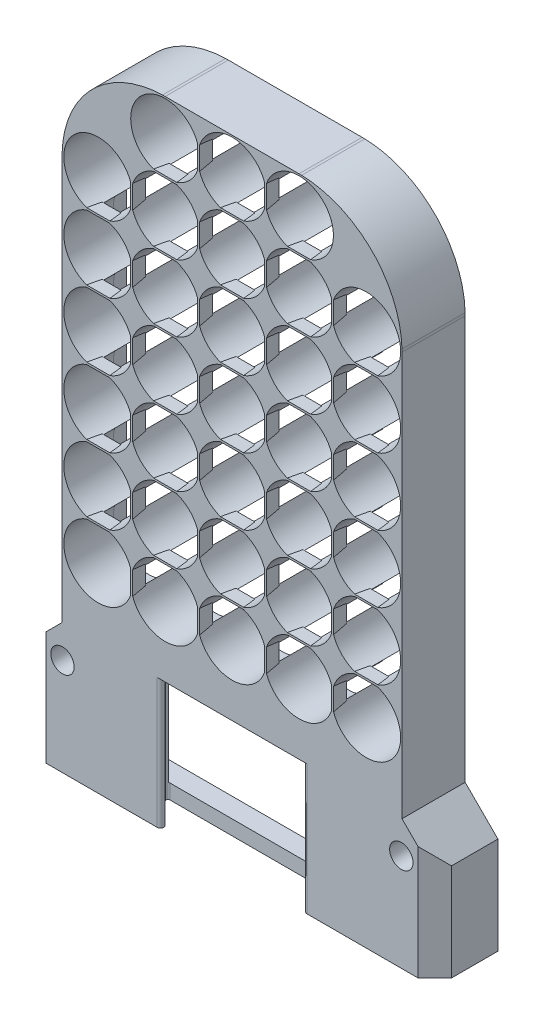
from build123d import *

# Parameters (mm, degrees)
BOSS_EXTRUDE1_DEPTH     = 7.44
BOSS_EXTRUDE2_DEPTH     = 2
BOSS_EXTRUDE3_START     = -90
BOSS_EXTRUDE3_DEPTH     = 61.267949192
BOSS_EXTRUDE3_START_2   = -35.267949192
BOSS_EXTRUDE3_2_DEPTH   = 11.267949192
BOSS_EXTRUDE3_START_3   = -150
BOSS_EXTRUDE3_3_DEPTH   = 45
BOSS_EXTRUDE3_START_4   = -145.717949192
BOSS_EXTRUDE3_4_DEPTH   = 36.585898384
SKETCH3_R               = 2
CUT_EXTRUDE1_DEPTH      = 5
CUT_EXTRUDE2_DEPTH      = 197.424683165
CUT_EXTRUDE2_DEPTH_BACK = 197.424683165
SKETCH3_3_R             = 1.75
SKETCH5_W               = 44.7
SKETCH5_H               = 9.35
SKETCH5_W_2             = 5.75
CUT_EXTRUDE4_DEPTH      = 3
CHAMFER1_SIZE           = 2.5
FILLET1_R               = 2
CUT_EXTRUDE5_DEPTH      = 185.400260716
CUT_EXTRUDE5_DEPTH_BACK = 19.41569
FILLET2_R               = 0.5
FILLET3_START           = -116.8
FILLET3_DEPTH           = 20.8
FILLET3_2_DEPTH         = 2.2


with BuildPart() as part:
    # Boss-Extrude1: read off the stored shape, not the designer's step
    # Boss-Extrude1 outline → Boss-Extrude1 (new body)
    # profile 1 of 23: a face of its own
    with BuildSketch(Plane.XY):
        with BuildLine():
            Line((-137.4513088, -21.6), (-137.84926681, -21.602604265))
            add(Edge.make_bspline(
                [(-137.84926681, -21.602604265), (-138.83224748, -21.628344539), (-139.797012541, -21.746478614), (-141.217778733, -22.057492317), (-141.686974424, -22.183446073), (-142.616297176, -22.481351779), (-143.078556166, -22.654380436), (-144.425538693, -23.232751514), (-145.276334986, -23.698482743), (-146.483154795, -24.51490475), (-146.873845835, -24.806716558), (-147.631022773, -25.431449942), (-147.993818982, -25.761528457), (-149.026143305, -26.793153314), (-149.644227383, -27.540113591), (-150.465753178, -28.749709063), (-150.723191535, -29.170186804), (-151.193408511, -30.028498367), (-151.40642385, -30.466061686), (-151.981781323, -31.802988292), (-152.280278036, -32.726647925), (-152.596808175, -34.162071159), (-152.679924825, -34.647584264), (-152.798636022, -35.620282225), (-152.834525316, -36.109232071), (-152.847395735, -36.60073319)],
                knots=[0, 0, 0, 0, 0.125, 0.125, 0.1875, 0.1875, 0.25, 0.25, 0.375, 0.375, 0.4375, 0.4375, 0.5, 0.5, 0.625, 0.625, 0.6875, 0.6875, 0.75, 0.75, 0.875, 0.875, 0.9375, 0.9375, 1, 1, 1, 1], degree=3))
            Line((-152.847395735, -36.60073319), (-152.85, -36.9986912))
            Line((-152.85, -36.9986912), (-152.85, -97.384314575))
            Line((-152.85, -97.384314575), (-157.75, -102.284314575))
            Line((-157.75, -102.284314575), (-157.75, -116.8))
            Line((-157.75, -116.8), (-97.15, -116.8))
            Line((-97.15, -116.8), (-97.15, -102.284314575))
            Line((-97.15, -102.284314575), (-102.05, -97.384314575))
            Line((-102.05, -97.384314575), (-102.05, -36.9986912))
            Line((-102.05, -36.9986912), (-102.052604265, -36.60073319))
            add(Edge.make_bspline(
                [(-102.052604265, -36.60073319), (-102.078344539, -35.61775252), (-102.196478614, -34.652987459), (-102.507492317, -33.232221267), (-102.633446073, -32.763025576), (-102.931351779, -31.833702824), (-103.104380436, -31.371443834), (-103.682751514, -30.024461307), (-104.148482743, -29.173665014), (-104.96490475, -27.966845205), (-105.256716558, -27.576154165), (-105.881449942, -26.818977227), (-106.211528457, -26.456181018), (-107.243153314, -25.423856695), (-107.990113591, -24.805772617), (-109.199709063, -23.984246822), (-109.620186804, -23.726808465), (-110.478498367, -23.256591489), (-110.916061686, -23.04357615), (-112.252988292, -22.468218677), (-113.176647925, -22.169721964), (-114.612071159, -21.853191825), (-115.097584264, -21.770075175), (-116.070282225, -21.651363978), (-116.559232071, -21.615474684), (-117.05073319, -21.602604265)],
                knots=[0, 0, 0, 0, 0.125, 0.125, 0.1875, 0.1875, 0.25, 0.25, 0.375, 0.375, 0.4375, 0.4375, 0.5, 0.5, 0.625, 0.625, 0.6875, 0.6875, 0.75, 0.75, 0.875, 0.875, 0.9375, 0.9375, 1, 1, 1, 1], degree=3))
            Line((-117.05073319, -21.602604265), (-117.4486912, -21.6))
            Line((-117.4486912, -21.6), (-137.4513088, -21.6))
        make_face()
        with BuildLine():
            ThreePointArc((-106.166103732, -52), (-102.25, -57), (-106.166103732, -62))
            ThreePointArc((-106.166103732, -62), (-102.25, -67), (-106.166103732, -72))
            ThreePointArc((-106.166103732, -72), (-102.25, -77), (-106.166103732, -82))
            ThreePointArc((-106.166103732, -82), (-103.797150916, -90.679942728), (-112.425, -88.127774357))
            ThreePointArc((-112.425, -88.127774357), (-117.395486561, -92.149711476), (-122.45, -88.233896268))
            ThreePointArc((-122.45, -88.233896268), (-127.45, -92.15), (-132.45, -88.233896268))
            ThreePointArc((-132.45, -88.233896268), (-137.45, -92.15), (-142.45, -88.233896268))
            ThreePointArc((-142.45, -88.233896268), (-151.091599923, -90.641599923), (-148.683896268, -82))
            ThreePointArc((-148.683896268, -82), (-152.6, -77), (-148.683896268, -72))
            ThreePointArc((-148.683896268, -72), (-152.6, -67), (-148.683896268, -62))
            ThreePointArc((-148.683896268, -62), (-152.6, -57), (-148.683896268, -52))
            ThreePointArc((-148.683896268, -52), (-152.6, -47), (-148.683896268, -42))
            ThreePointArc((-148.683896268, -42), (-151.091599923, -33.358400077), (-142.45, -35.766103732))
            ThreePointArc((-142.45, -35.766103732), (-141.091599923, -33.358400077), (-138.683896268, -32))
            ThreePointArc((-138.683896268, -32), (-141.091599923, -23.358400077), (-132.45, -25.766103732))
            ThreePointArc((-132.45, -25.766103732), (-127.45, -21.85), (-122.45, -25.766103732))
            ThreePointArc((-122.45, -25.766103732), (-113.808400077, -23.358400077), (-116.216103732, -32))
            ThreePointArc((-116.216103732, -32), (-113.770057272, -33.397150916), (-112.425, -35.872225643))
            ThreePointArc((-112.425, -35.872225643), (-103.797150916, -33.320057272), (-106.166103732, -42))
            ThreePointArc((-106.166103732, -42), (-102.25, -47), (-106.166103732, -52))
        make_face(mode=Mode.SUBTRACT)
    # profile 2 of 23: a face of its own
    with BuildSketch(Plane.XY):
        with BuildLine():
            ThreePointArc((-146.216103732, -42), (-143.808400077, -43.358400077), (-142.45, -45.766103732))
            ThreePointArc((-142.45, -45.766103732), (-141.091599923, -43.358400077), (-138.683896268, -42))
            ThreePointArc((-138.683896268, -42), (-141.091599923, -40.641599923), (-142.45, -38.233896268))
            ThreePointArc((-142.45, -38.233896268), (-143.808400077, -40.641599923), (-146.216103732, -42))
        make_face()
    # profile 3 of 23: a face of its own
    with BuildSketch(Plane.XY):
        with BuildLine():
            ThreePointArc((-112.425, -78.127774357), (-113.770057272, -80.602849084), (-116.216103732, -82))
            ThreePointArc((-116.216103732, -82), (-113.770057272, -83.397150916), (-112.425, -85.872225643))
            ThreePointArc((-112.425, -85.872225643), (-111.079942728, -83.397150916), (-108.633896268, -82))
            ThreePointArc((-108.633896268, -82), (-111.079942728, -80.602849084), (-112.425, -78.127774357))
        make_face()
    # profile 4 of 23: a face of its own
    with BuildSketch(Plane.XY):
        with BuildLine():
            ThreePointArc((-126.216103732, -82), (-123.808400077, -83.358400077), (-122.45, -85.766103732))
            ThreePointArc((-122.45, -85.766103732), (-121.091599923, -83.358400077), (-118.683896268, -82))
            ThreePointArc((-118.683896268, -82), (-121.091599923, -80.641599923), (-122.45, -78.233896268))
            ThreePointArc((-122.45, -78.233896268), (-123.808400077, -80.641599923), (-126.216103732, -82))
        make_face()
    # profile 5 of 23: a face of its own
    with BuildSketch(Plane.XY):
        with BuildLine():
            ThreePointArc((-136.216103732, -82), (-133.808400077, -83.358400077), (-132.45, -85.766103732))
            ThreePointArc((-132.45, -85.766103732), (-131.091599923, -83.358400077), (-128.683896268, -82))
            ThreePointArc((-128.683896268, -82), (-131.091599923, -80.641599923), (-132.45, -78.233896268))
            ThreePointArc((-132.45, -78.233896268), (-133.808400077, -80.641599923), (-136.216103732, -82))
        make_face()
    # profile 6 of 23: a face of its own
    with BuildSketch(Plane.XY):
        with BuildLine():
            ThreePointArc((-146.216103732, -82), (-143.808400077, -83.358400077), (-142.45, -85.766103732))
            ThreePointArc((-142.45, -85.766103732), (-141.091599923, -83.358400077), (-138.683896268, -82))
            ThreePointArc((-138.683896268, -82), (-141.091599923, -80.641599923), (-142.45, -78.233896268))
            ThreePointArc((-142.45, -78.233896268), (-143.808400077, -80.641599923), (-146.216103732, -82))
        make_face()
    # profile 7 of 23: a face of its own
    with BuildSketch(Plane.XY):
        with BuildLine():
            ThreePointArc((-146.216103732, -72), (-143.808400077, -73.358400077), (-142.45, -75.766103732))
            ThreePointArc((-142.45, -75.766103732), (-141.091599923, -73.358400077), (-138.683896268, -72))
            ThreePointArc((-138.683896268, -72), (-141.091599923, -70.641599923), (-142.45, -68.233896268))
            ThreePointArc((-142.45, -68.233896268), (-143.808400077, -70.641599923), (-146.216103732, -72))
        make_face()
    # profile 8 of 23: a face of its own
    with BuildSketch(Plane.XY):
        with BuildLine():
            ThreePointArc((-132.45, -68.233896268), (-133.808400077, -70.641599923), (-136.216103732, -72))
            ThreePointArc((-136.216103732, -72), (-133.808400077, -73.358400077), (-132.45, -75.766103732))
            ThreePointArc((-132.45, -75.766103732), (-131.091599923, -73.358400077), (-128.683896268, -72))
            ThreePointArc((-128.683896268, -72), (-131.091599923, -70.641599923), (-132.45, -68.233896268))
        make_face()
    # profile 9 of 23: a face of its own
    with BuildSketch(Plane.XY):
        with BuildLine():
            ThreePointArc((-122.45, -68.233896268), (-123.808400077, -70.641599923), (-126.216103732, -72))
            ThreePointArc((-126.216103732, -72), (-123.808400077, -73.358400077), (-122.45, -75.766103732))
            ThreePointArc((-122.45, -75.766103732), (-121.091599923, -73.358400077), (-118.683896268, -72))
            ThreePointArc((-118.683896268, -72), (-121.091599923, -70.641599923), (-122.45, -68.233896268))
        make_face()
    # profile 10 of 23: a face of its own
    with BuildSketch(Plane.XY):
        with BuildLine():
            ThreePointArc((-112.425, -68.127774357), (-113.770057272, -70.602849084), (-116.216103732, -72))
            ThreePointArc((-116.216103732, -72), (-113.770057272, -73.397150916), (-112.425, -75.872225643))
            ThreePointArc((-112.425, -75.872225643), (-111.079942728, -73.397150916), (-108.633896268, -72))
            ThreePointArc((-108.633896268, -72), (-111.079942728, -70.602849084), (-112.425, -68.127774357))
        make_face()
    # profile 11 of 23: a face of its own
    with BuildSketch(Plane.XY):
        with BuildLine():
            ThreePointArc((-112.425, -58.127774357), (-113.770057272, -60.602849084), (-116.216103732, -62))
            ThreePointArc((-116.216103732, -62), (-113.770057272, -63.397150916), (-112.425, -65.872225643))
            ThreePointArc((-112.425, -65.872225643), (-111.079942728, -63.397150916), (-108.633896268, -62))
            ThreePointArc((-108.633896268, -62), (-111.079942728, -60.602849084), (-112.425, -58.127774357))
        make_face()
    # profile 12 of 23: a face of its own
    with BuildSketch(Plane.XY):
        with BuildLine():
            ThreePointArc((-126.216103732, -62), (-123.808400077, -63.358400077), (-122.45, -65.766103732))
            ThreePointArc((-122.45, -65.766103732), (-121.091599923, -63.358400077), (-118.683896268, -62))
            ThreePointArc((-118.683896268, -62), (-121.091599923, -60.641599923), (-122.45, -58.233896268))
            ThreePointArc((-122.45, -58.233896268), (-123.808400077, -60.641599923), (-126.216103732, -62))
        make_face()
    # profile 13 of 23: a face of its own
    with BuildSketch(Plane.XY):
        with BuildLine():
            ThreePointArc((-136.216103732, -62), (-133.808400077, -63.358400077), (-132.45, -65.766103732))
            ThreePointArc((-132.45, -65.766103732), (-131.091599923, -63.358400077), (-128.683896268, -62))
            ThreePointArc((-128.683896268, -62), (-131.091599923, -60.641599923), (-132.45, -58.233896268))
            ThreePointArc((-132.45, -58.233896268), (-133.808400077, -60.641599923), (-136.216103732, -62))
        make_face()
    # profile 14 of 23: a face of its own
    with BuildSketch(Plane.XY):
        with BuildLine():
            ThreePointArc((-146.216103732, -62), (-143.808400077, -63.358400077), (-142.45, -65.766103732))
            ThreePointArc((-142.45, -65.766103732), (-141.091599923, -63.358400077), (-138.683896268, -62))
            ThreePointArc((-138.683896268, -62), (-141.091599923, -60.641599923), (-142.45, -58.233896268))
            ThreePointArc((-142.45, -58.233896268), (-143.808400077, -60.641599923), (-146.216103732, -62))
        make_face()
    # profile 15 of 23: a face of its own
    with BuildSketch(Plane.XY):
        with BuildLine():
            ThreePointArc((-146.216103732, -52), (-143.808400077, -53.358400077), (-142.45, -55.766103732))
            ThreePointArc((-142.45, -55.766103732), (-141.091599923, -53.358400077), (-138.683896268, -52))
            ThreePointArc((-138.683896268, -52), (-141.091599923, -50.641599923), (-142.45, -48.233896268))
            ThreePointArc((-142.45, -48.233896268), (-143.808400077, -50.641599923), (-146.216103732, -52))
        make_face()
    # profile 16 of 23: a face of its own
    with BuildSketch(Plane.XY):
        with BuildLine():
            ThreePointArc((-132.45, -48.233896268), (-133.808400077, -50.641599923), (-136.216103732, -52))
            ThreePointArc((-136.216103732, -52), (-133.808400077, -53.358400077), (-132.45, -55.766103732))
            ThreePointArc((-132.45, -55.766103732), (-131.091599923, -53.358400077), (-128.683896268, -52))
            ThreePointArc((-128.683896268, -52), (-131.091599923, -50.641599923), (-132.45, -48.233896268))
        make_face()
    # profile 17 of 23: a face of its own
    with BuildSketch(Plane.XY):
        with BuildLine():
            ThreePointArc((-122.45, -48.233896268), (-123.808400077, -50.641599923), (-126.216103732, -52))
            ThreePointArc((-126.216103732, -52), (-123.808400077, -53.358400077), (-122.45, -55.766103732))
            ThreePointArc((-122.45, -55.766103732), (-121.091599923, -53.358400077), (-118.683896268, -52))
            ThreePointArc((-118.683896268, -52), (-121.091599923, -50.641599923), (-122.45, -48.233896268))
        make_face()
    # profile 18 of 23: a face of its own
    with BuildSketch(Plane.XY):
        with BuildLine():
            ThreePointArc((-112.425, -48.127774357), (-113.770057272, -50.602849084), (-116.216103732, -52))
            ThreePointArc((-116.216103732, -52), (-113.770057272, -53.397150916), (-112.425, -55.872225643))
            ThreePointArc((-112.425, -55.872225643), (-111.079942728, -53.397150916), (-108.633896268, -52))
            ThreePointArc((-108.633896268, -52), (-111.079942728, -50.602849084), (-112.425, -48.127774357))
        make_face()
    # profile 19 of 23: a face of its own
    with BuildSketch(Plane.XY):
        with BuildLine():
            ThreePointArc((-112.425, -38.127774357), (-113.770057272, -40.602849084), (-116.216103732, -42))
            ThreePointArc((-116.216103732, -42), (-113.770057272, -43.397150916), (-112.425, -45.872225643))
            ThreePointArc((-112.425, -45.872225643), (-111.079942728, -43.397150916), (-108.633896268, -42))
            ThreePointArc((-108.633896268, -42), (-111.079942728, -40.602849084), (-112.425, -38.127774357))
        make_face()
    # profile 20 of 23: a face of its own
    with BuildSketch(Plane.XY):
        with BuildLine():
            ThreePointArc((-136.216103732, -42), (-133.808400077, -43.358400077), (-132.45, -45.766103732))
            ThreePointArc((-132.45, -45.766103732), (-131.091599923, -43.358400077), (-128.683896268, -42))
            ThreePointArc((-128.683896268, -42), (-131.091599923, -40.641599923), (-132.45, -38.233896268))
            ThreePointArc((-132.45, -38.233896268), (-133.808400077, -40.641599923), (-136.216103732, -42))
        make_face()
    # profile 21 of 23: a face of its own
    with BuildSketch(Plane.XY):
        with BuildLine():
            ThreePointArc((-126.216103732, -42), (-123.808400077, -43.358400077), (-122.45, -45.766103732))
            ThreePointArc((-122.45, -45.766103732), (-121.091599923, -43.358400077), (-118.683896268, -42))
            ThreePointArc((-118.683896268, -42), (-121.091599923, -40.641599923), (-122.45, -38.233896268))
            ThreePointArc((-122.45, -38.233896268), (-123.808400077, -40.641599923), (-126.216103732, -42))
        make_face()
    # profile 22 of 23: a face of its own
    with BuildSketch(Plane.XY):
        with BuildLine():
            ThreePointArc((-122.45, -28.233896268), (-123.808400077, -30.641599923), (-126.216103732, -32))
            ThreePointArc((-126.216103732, -32), (-123.808400077, -33.358400077), (-122.45, -35.766103732))
            ThreePointArc((-122.45, -35.766103732), (-121.091599923, -33.358400077), (-118.683896268, -32))
            ThreePointArc((-118.683896268, -32), (-121.091599923, -30.641599923), (-122.45, -28.233896268))
        make_face()
    # profile 23 of 23: a face of its own
    with BuildSketch(Plane.XY):
        with BuildLine():
            ThreePointArc((-136.216103732, -32), (-133.808400077, -33.358400077), (-132.45, -35.766103732))
            ThreePointArc((-132.45, -35.766103732), (-131.091599923, -33.358400077), (-128.683896268, -32))
            ThreePointArc((-128.683896268, -32), (-131.091599923, -30.641599923), (-132.45, -28.233896268))
            ThreePointArc((-132.45, -28.233896268), (-133.808400077, -30.641599923), (-136.216103732, -32))
        make_face()
    extrude(amount=BOSS_EXTRUDE1_DEPTH)

    # Sketch1<3> → Boss-Extrude2 (add)
    with BuildSketch(Plane.XY):
        with BuildLine():
            Line((-102.05, -97.384314575), (-102.05, -36.9986912))
            Line((-102.05, -36.9986912), (-102.052604265, -36.60073319))
            add(Edge.make_bspline(
                [(-102.052604265, -36.60073319), (-102.078344539, -35.61775252), (-102.196478614, -34.652987459), (-102.507492317, -33.232221267), (-102.633446073, -32.763025576), (-102.931351779, -31.833702824), (-103.104380436, -31.371443834), (-103.682751514, -30.024461307), (-104.148482743, -29.173665014), (-104.96490475, -27.966845205), (-105.256716558, -27.576154165), (-105.881449942, -26.818977227), (-106.211528457, -26.456181018), (-107.243153314, -25.423856695), (-107.990113591, -24.805772617), (-109.199709063, -23.984246822), (-109.620186804, -23.726808465), (-110.478498367, -23.256591489), (-110.916061686, -23.04357615), (-112.252988292, -22.468218677), (-113.176647925, -22.169721964), (-114.612071159, -21.853191825), (-115.097584264, -21.770075175), (-116.070282225, -21.651363978), (-116.559232071, -21.615474684), (-117.05073319, -21.602604265)],
                knots=[0, 0, 0, 0, 0.125, 0.125, 0.1875, 0.1875, 0.25, 0.25, 0.375, 0.375, 0.4375, 0.4375, 0.5, 0.5, 0.625, 0.625, 0.6875, 0.6875, 0.75, 0.75, 0.875, 0.875, 0.9375, 0.9375, 1, 1, 1, 1], degree=3))
            Line((-117.05073319, -21.602604265), (-117.4486912, -21.6))
            Line((-117.4486912, -21.6), (-137.4513088, -21.6))
            Line((-137.4513088, -21.6), (-137.84926681, -21.602604265))
            add(Edge.make_bspline(
                [(-137.84926681, -21.602604265), (-138.83224748, -21.628344539), (-139.797012541, -21.746478614), (-141.217778733, -22.057492317), (-141.686974424, -22.183446073), (-142.616297176, -22.481351779), (-143.078556166, -22.654380436), (-144.425538693, -23.232751514), (-145.276334986, -23.698482743), (-146.483154795, -24.51490475), (-146.873845835, -24.806716558), (-147.631022773, -25.431449942), (-147.993818982, -25.761528457), (-149.026143305, -26.793153314), (-149.644227383, -27.540113591), (-150.465753178, -28.749709063), (-150.723191535, -29.170186804), (-151.193408511, -30.028498367), (-151.40642385, -30.466061686), (-151.981781323, -31.802988292), (-152.280278036, -32.726647925), (-152.596808175, -34.162071159), (-152.679924825, -34.647584264), (-152.798636022, -35.620282225), (-152.834525316, -36.109232071), (-152.847395735, -36.60073319)],
                knots=[0, 0, 0, 0, 0.125, 0.125, 0.1875, 0.1875, 0.25, 0.25, 0.375, 0.375, 0.4375, 0.4375, 0.5, 0.5, 0.625, 0.625, 0.6875, 0.6875, 0.75, 0.75, 0.875, 0.875, 0.9375, 0.9375, 1, 1, 1, 1], degree=3))
            Line((-152.847395735, -36.60073319), (-152.85, -36.9986912))
            Line((-152.85, -36.9986912), (-152.85, -97.384314575))
            Line((-152.85, -97.384314575), (-157.75, -102.284314575))
            Line((-157.75, -102.284314575), (-157.75, -116.8))
            Line((-157.75, -116.8), (-97.15, -116.8))
            Line((-97.15, -116.8), (-97.15, -102.284314575))
            Line((-97.15, -102.284314575), (-102.05, -97.384314575))
        make_face()
        with BuildLine():
            Line((-102.25, -97.467157288), (-102.25, -36.999345593))
            Line((-102.25, -36.999345593), (-102.252587091, -36.604011921))
            add(Edge.make_bspline(
                [(-102.252587091, -36.604011921), (-102.30288603, -34.69244573), (-102.9384763, -31.801061253), (-104.778899462, -28.435479961), (-106.637953121, -26.18311878), (-108.850524504, -24.352722567), (-111.410816406, -22.948851296), (-114.145478334, -22.067164187), (-116.087618315, -21.828015045), (-117.054011884, -21.802587091)],
                knots=[8.4016e-05, 8.4016e-05, 8.4016e-05, 8.4016e-05, 0.25004201, 0.375021007, 0.500000003, 0.624979, 0.749957997, 0.874936994, 0.999915991, 0.999915991, 0.999915991, 0.999915991], degree=3))
            Line((-117.054011884, -21.802587091), (-117.449345607, -21.8))
            Line((-117.449345607, -21.8), (-137.450654407, -21.8))
            Line((-137.450654407, -21.8), (-137.845988079, -21.802587091))
            add(Edge.make_bspline(
                [(-137.845988079, -21.802587091), (-139.75755427, -21.85288603), (-142.648938747, -22.4884763), (-146.014520039, -24.328899462), (-148.26688122, -26.187953121), (-150.097277433, -28.400524504), (-151.501148704, -30.960816406), (-152.382835813, -33.695478334), (-152.621984955, -35.637618315), (-152.647412909, -36.604011884)],
                knots=[8.4016e-05, 8.4016e-05, 8.4016e-05, 8.4016e-05, 0.25004201, 0.375021007, 0.500000003, 0.624979, 0.749957997, 0.874936994, 0.999915991, 0.999915991, 0.999915991, 0.999915991], degree=3))
            Line((-152.647412909, -36.604011884), (-152.65, -36.999345607))
            Line((-152.65, -36.999345607), (-152.65, -97.467157288))
            Line((-152.65, -97.467157288), (-157.55, -102.367157288))
            Line((-157.55, -102.367157288), (-157.55, -116.6))
            Line((-157.55, -116.6), (-97.35, -116.6))
            Line((-97.35, -116.6), (-97.35, -102.367157288))
            Line((-97.35, -102.367157288), (-102.25, -97.467157288))
        make_face(mode=Mode.SUBTRACT)
    extrude(amount=-BOSS_EXTRUDE2_DEPTH)

    # Boss-Extrude3: read off the stored shape, not the designer's step
    # Boss-Extrude3 outline → Boss-Extrude3 (add)
    with BuildSketch(Plane(origin=(0, 0, 0), x_dir=(1, 0, 0), z_dir=(0, 1, 0)).offset(BOSS_EXTRUDE3_START)):
        Polygon((-142.6, -7.44), (-142.3, -7.44), (-142.404815559, -5.44), (-142.495184441, -5.44), align=None)
        Polygon((-132.6, -7.44), (-132.3, -7.44), (-132.404815559, -5.44), (-132.495184441, -5.44), align=None)
        Polygon((-122.6, -7.44), (-122.3, -7.44), (-122.404815559, -5.44), (-122.495184441, -5.44), align=None)
        Polygon((-112.379815559, -5.44), (-112.470184441, -5.44), (-112.575, -7.44), (-112.275, -7.44), align=None)
    extrude(amount=BOSS_EXTRUDE3_DEPTH)

    # Boss-Extrude3 2 outline → Boss-Extrude3 2 (add)
    with BuildSketch(Plane(origin=(0, 0, 0), x_dir=(1, 0, 0), z_dir=(0, 1, 0)).offset(BOSS_EXTRUDE3_START_2)):
        Polygon((-132.6, -7.44), (-132.3, -7.44), (-132.404815559, -5.44), (-132.495184441, -5.44), align=None)
        Polygon((-122.6, -7.44), (-122.3, -7.44), (-122.404815559, -5.44), (-122.495184441, -5.44), align=None)
    extrude(amount=BOSS_EXTRUDE3_2_DEPTH)

    # Boss-Extrude3 3 outline → Boss-Extrude3 3 (add)
    with BuildSketch(Plane.YZ.offset(BOSS_EXTRUDE3_START_3)):
        Polygon((-41.85, 7.44), (-42.15, 7.44), (-42.045184441, 5.44), (-41.954815559, 5.44), align=None)
        Polygon((-51.85, 7.44), (-52.15, 7.44), (-52.045184441, 5.44), (-51.954815559, 5.44), align=None)
        Polygon((-61.85, 7.44), (-62.15, 7.44), (-62.045184441, 5.44), (-61.954815559, 5.44), align=None)
        Polygon((-71.85, 7.44), (-72.15, 7.44), (-72.045184441, 5.44), (-71.954815559, 5.44), align=None)
        Polygon((-82.045184441, 5.44), (-81.954815559, 5.44), (-81.85, 7.44), (-82.15, 7.44), align=None)
    extrude(amount=BOSS_EXTRUDE3_3_DEPTH)

    # Boss-Extrude3 4 outline → Boss-Extrude3 4 (add)
    with BuildSketch(Plane.YZ.offset(BOSS_EXTRUDE3_START_4)):
        Polygon((-31.85, 7.44), (-32.15, 7.44), (-32.045184441, 5.44), (-31.954815559, 5.44), align=None)
    extrude(amount=BOSS_EXTRUDE3_4_DEPTH)

    # Sketch3 → Cut-Extrude1 (cut)
    with BuildSketch(Plane(origin=(0, 0, 0), x_dir=(-1, 0, 0), z_dir=(0, 0, -1))):
        with Locations((109.05, -28.6)):
            Circle(SKETCH3_R)
        with Locations((145.85, -28.6)):
            Circle(SKETCH3_R)
    extrude(amount=-CUT_EXTRUDE1_DEPTH, mode=Mode.SUBTRACT)

    # Sketch3<3> → Cut-Extrude2 (cut, two sides: drawn at the far end of the back side and taken through both)
    with BuildSketch(Plane(origin=(0, 0, 0), x_dir=(-1, 0, 0), z_dir=(0, 0, -1)).offset(-CUT_EXTRUDE2_DEPTH_BACK)):
        with Locations(Location((102.15, -102.25, 0), (0, 0, 180))):
            Circle(SKETCH3_3_R)
        with Locations(Location((152.8, -102.25, 0), (0, 0, 180))):
            Circle(SKETCH3_3_R)
    extrude(amount=CUT_EXTRUDE2_DEPTH + CUT_EXTRUDE2_DEPTH_BACK, mode=Mode.SUBTRACT)

    # Sketch5 → Cut-Extrude4 (cut)
    with BuildSketch(Plane(origin=(0, 0, 0), x_dir=(-1, 0, 0), z_dir=(0, 0, -1))):
        with Locations((127.45, -100.575)):
            Rectangle(SKETCH5_W, SKETCH5_H)
        with Locations((127.45, -109.925)):
            Rectangle(SKETCH5_W, SKETCH5_H)
        with Locations((102.225, -109.925)):
            Rectangle(SKETCH5_W_2, SKETCH5_H)
        with Locations((152.675, -109.925)):
            Rectangle(SKETCH5_W_2, SKETCH5_H)
    extrude(amount=-CUT_EXTRUDE4_DEPTH, mode=Mode.SUBTRACT)

    # Chamfer1
    chamfer1_edges = [part.edges().sort_by_distance(p)[0] for p in [
        (-157.75, -109.542157288, 7.44),
        (-97.15, -109.542157288, 7.44),
    ]]
    chamfer(chamfer1_edges, length=CHAMFER1_SIZE)

    # Fillet1
    fillet1_edges = [part.edges().sort_by_distance(p)[0] for p in [
        (-149.8, -95.9, 1.5),
        (-149.8, -105.25, 1.5),
        (-155.55, -105.25, 1.5),
        (-155.55, -114.6, 1.5),
        (-99.35, -114.6, 1.5),
        (-99.35, -105.25, 1.5),
        (-105.1, -105.25, 1.5),
        (-105.1, -95.9, 1.5),
    ]]
    fillet(fillet1_edges, radius=FILLET1_R)

    # Sketch6 → Cut-Extrude5 (cut, two sides: drawn at the far end of the back side and taken through both)
    with BuildSketch(Plane.XZ.offset(116.8).offset(-CUT_EXTRUDE5_DEPTH_BACK)):
        Polygon((-137.45, 7.44), (-117.45, 7.44), (-112.95, 2.94), (-141.95, 2.94), align=None)
    extrude(amount=CUT_EXTRUDE5_DEPTH + CUT_EXTRUDE5_DEPTH_BACK, mode=Mode.SUBTRACT)

    # Fillet2
    fillet2_edges = [part.edges().sort_by_distance(p)[0] for p in [
        (-137.45, -107.092155, 7.44),
        (-117.45, -107.092155, 7.44),
    ]]
    fillet(fillet2_edges, radius=FILLET2_R)

    # Fillet3: read off the stored shape, not the designer's step
    # Fillet3 outline → Fillet3 (add)
    with BuildSketch(Plane(origin=(0, 0, 0), x_dir=(1, 0, 0), z_dir=(0, 1, 0)).offset(FILLET3_START)):
        with BuildLine():
            ThreePointArc((-113.494264069, -3), (-113.375018806, -3.218733294), (-113.462132034, -3.452132034))
            Line((-113.462132034, -3.452132034), (-113.01, -3))
            Line((-113.01, -3), (-113.494264069, -3))
        make_face()
        with BuildLine():
            ThreePointArc((-141.437867966, -3.452132034), (-141.524981194, -3.218733294), (-141.405735931, -3))
            Line((-141.405735931, -3), (-141.89, -3))
            Line((-141.89, -3), (-141.437867966, -3.452132034))
        make_face()
    extrude(amount=FILLET3_DEPTH)

    # Fillet3 2 outline → Fillet3 2 (add)
    with BuildSketch(Plane(origin=(0, 0, 0), x_dir=(1, 0, 0), z_dir=(0, 1, 0)).offset(FILLET3_START)):
        with BuildLine():
            ThreePointArc((-113.674264069, -2.94), (-113.579395739, -2.955395011), (-113.494264069, -3))
            Line((-113.494264069, -3), (-113.01, -3))
            Line((-113.01, -3), (-112.95, -2.94))
            Line((-112.95, -2.94), (-113.674264069, -2.94))
        make_face()
        with BuildLine():
            Line((-141.89, -3), (-141.405735931, -3))
            ThreePointArc((-141.405735931, -3), (-141.320604261, -2.955395011), (-141.225735931, -2.94))
            Line((-141.225735931, -2.94), (-141.95, -2.94))
            Line((-141.95, -2.94), (-141.89, -3))
        make_face()
    extrude(amount=FILLET3_2_DEPTH)


solid = part.part
